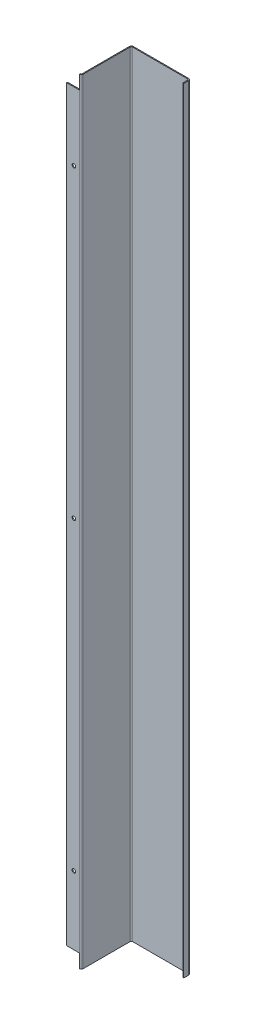
from build123d import *

# Parameters (mm, degrees)
SKETCH1_W                    = 130
SKETCH1_H                    = 1700
BASE_FLANGE1_DEPTH           = 2
EDGE_FLANGE1_STRIP_W         = 13
EDGE_FLANGE1_STRIP_H         = 2
EDGE_FLANGE1_STRIP_CUT_DEPTH = 1700
EDGE_FLANGE1_DEPTH           = 1700
EDGE_FLANGE2_STRIP_W         = 13
EDGE_FLANGE2_STRIP_H         = 2
EDGE_FLANGE2_STRIP_CUT_DEPTH = 1700
EDGE_FLANGE2_DEPTH           = 1700
EDGE_FLANGE3_STRIP_W         = 12
EDGE_FLANGE3_STRIP_H         = 2
EDGE_FLANGE3_STRIP_CUT_DEPTH = 1700
EDGE_FLANGE3_DEPTH           = 1700
CUT_EXTRUDE1_DEPTH           = 1415.486194049
CUT_EXTRUDE1_DEPTH_BACK      = 1415.486194049
SKETCH15_W                   = 28
SKETCH15_H                   = 30
SKETCH16_R                   = 4
CUT_EXTRUDE2_DEPTH           = 10


# Sheet-metal steps are written as plain solids
with BuildPart() as part:
    # Sketch1 → Base-Flange1 (new body)
    with BuildSketch(Plane.XY):
        with Locations((36.609195402, -556.379310345)):
            Rectangle(SKETCH1_W, SKETCH1_H)
    extrude(amount=-BASE_FLANGE1_DEPTH)

    # Edge-Flange1 strip (across the edge) → Edge-Flange1 strip cut (cut)
    with BuildSketch(Plane(origin=(101.609195402, -1406.379310345, 0), x_dir=(-1, 0, 0), z_dir=(0, 1, 0))):
        with Locations((-2, -1)):
            Rectangle(EDGE_FLANGE1_STRIP_W, EDGE_FLANGE1_STRIP_H)
    extrude(amount=EDGE_FLANGE1_STRIP_CUT_DEPTH, mode=Mode.SUBTRACT)

    # Edge-Flange1 section (across the edge) → Edge-Flange1 (add)
    with BuildSketch(Plane(origin=(101.609195402, -1406.379310345, 0), x_dir=(-1, 0, 0), z_dir=(0, 1, 0))):
        with BuildLine():
            Line((0, 2.5), (0, 13))
            Line((0, 13), (2, 13))
            Line((2, 13), (2, 2.5))
            ThreePointArc((2, 2.5), (2.732233047, 0.732233047), (4.5, 0))
            Line((4.5, 0), (4.5, -2))
            ThreePointArc((4.5, -2), (1.318019485, -0.681980515), (0, 2.5))
        make_face()
    extrude(amount=EDGE_FLANGE1_DEPTH)

    # Edge-Flange2 strip (across the edge) → Edge-Flange2 strip cut (cut)
    with BuildSketch(Plane(origin=(-28.390804598, 293.620689655, 0), x_dir=(1, 0, 0), z_dir=(0, -1, 0))):
        with Locations((-2, -1)):
            Rectangle(EDGE_FLANGE2_STRIP_W, EDGE_FLANGE2_STRIP_H)
    extrude(amount=EDGE_FLANGE2_STRIP_CUT_DEPTH, mode=Mode.SUBTRACT)

    # Edge-Flange2 section (across the edge) → Edge-Flange2 (add)
    with BuildSketch(Plane(origin=(-28.390804598, 293.620689655, 0), x_dir=(1, 0, 0), z_dir=(0, -1, 0))):
        with BuildLine():
            Line((0, 2.5), (0, 108))
            Line((0, 108), (2, 108))
            Line((2, 108), (2, 2.5))
            ThreePointArc((2, 2.5), (2.732233047, 0.732233047), (4.5, 0))
            Line((4.5, 0), (4.5, -2))
            ThreePointArc((4.5, -2), (1.318019485, -0.681980515), (0, 2.5))
        make_face()
    extrude(amount=EDGE_FLANGE2_DEPTH)

    # Edge-Flange3 strip (across the edge) → Edge-Flange3 strip cut (cut)
    with BuildSketch(Plane(origin=(-28.390804598, -1406.379310345, 108), x_dir=(0, 0, -1), z_dir=(0, 1, 0))):
        with Locations((-4, -1)):
            Rectangle(EDGE_FLANGE3_STRIP_W, EDGE_FLANGE3_STRIP_H)
    extrude(amount=EDGE_FLANGE3_STRIP_CUT_DEPTH, mode=Mode.SUBTRACT)

    # Edge-Flange3 section (across the edge) → Edge-Flange3 (add)
    with BuildSketch(Plane(origin=(-28.390804598, -1406.379310345, 108), x_dir=(0, 0, -1), z_dir=(0, 1, 0))):
        with BuildLine():
            Line((-2, 2), (-2, 30))
            Line((-2, 30), (0, 30))
            Line((0, 30), (0, 2))
            ThreePointArc((0, 2), (0.585786438, 0.585786438), (2, 0))
            Line((2, 0), (2, -2))
            ThreePointArc((2, -2), (-0.828427125, -0.828427125), (-2, 2))
        make_face()
    extrude(amount=EDGE_FLANGE3_DEPTH)

    # Sketch15 → Cut-Extrude1 (cut, two sides: drawn at the far end of the back side and taken through both)
    with BuildSketch(Plane.XY.offset(110).offset(-CUT_EXTRUDE1_DEPTH_BACK)):
        with Locations((-44.390804598, -1391.379310345)):
            Rectangle(SKETCH15_W, SKETCH15_H)
        with Locations((-44.390804598, 278.620689655)):
            Rectangle(SKETCH15_W, SKETCH15_H)
    extrude(amount=CUT_EXTRUDE1_DEPTH + CUT_EXTRUDE1_DEPTH_BACK, mode=Mode.SUBTRACT)

    # Sketch16 → Cut-Extrude2 (cut)
    with BuildSketch(Plane.XY.offset(110)):
        with Locations((-42.390804598, -1226.379310345)):
            Circle(SKETCH16_R)
        with Locations((-42.390841166, -556.379310345)):
            Circle(SKETCH16_R)
        with Locations((-42.390877735, 113.620689655)):
            Circle(SKETCH16_R)
    extrude(amount=-CUT_EXTRUDE2_DEPTH, mode=Mode.SUBTRACT)


solid = part.part
